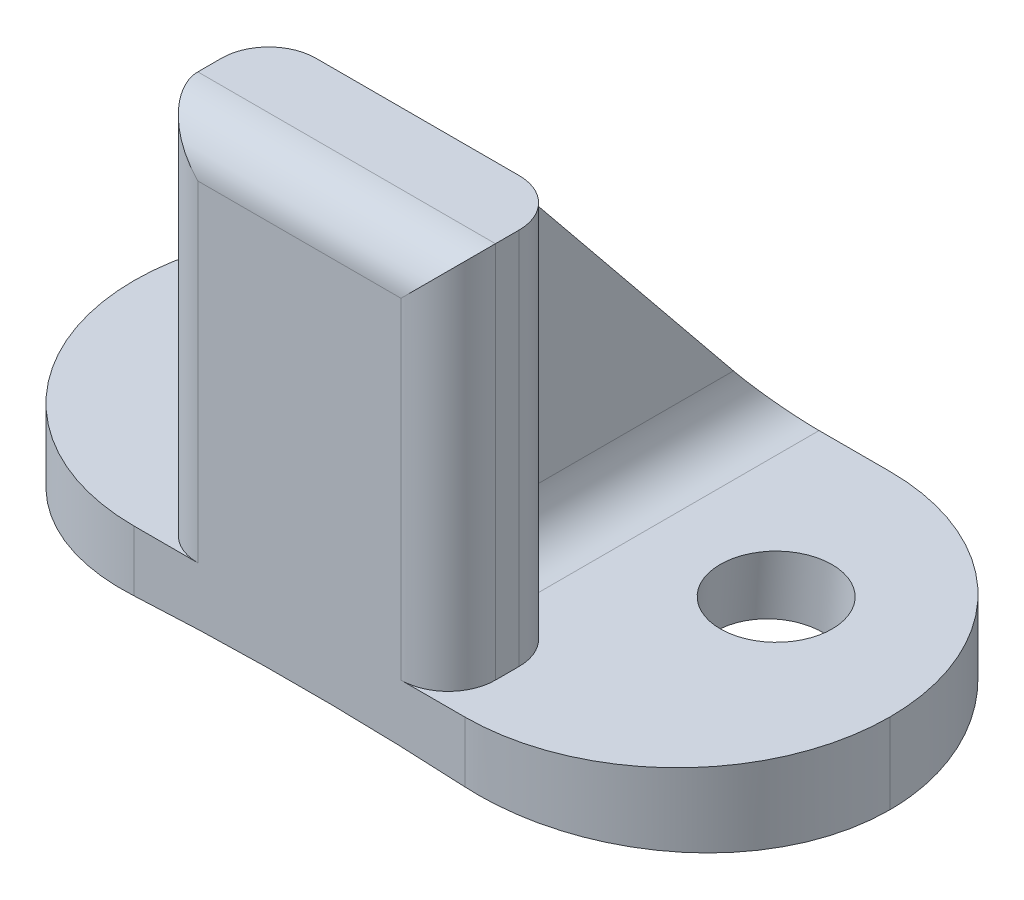
from build123d import *

# Parameters (mm, degrees)
SKETCH1_W               = 20.32
SKETCH1_H               = 23.8125
BOSS_EXTRUDE1_DEPTH     = 3
SKETCH3_R               = 1.500000048
CUT_EXTRUDE1_DEPTH      = 84.279291716
CUT_EXTRUDE2_DEPTH      = 23.075453704
CUT_EXTRUDE2_DEPTH_BACK = 23.075453704
SKETCH2_R               = 78.359
SKETCH4_W               = 22.86
SKETCH4_H               = 20.306074834
CUT_EXTRUDE3_DEPTH      = 12.3825
SKETCH9_W               = 8
SKETCH9_H               = 3.175
BOSS_EXTRUDE2_DEPTH     = 10.16
BOSS_EXTRUDE3_DEPTH     = 1.27
FILLET7_R               = 5.715
FILLET8_R               = 1.27
FILLET9_R               = 1.27


# Some blends are built 0.0001 mm under size
with BuildPart() as part:
    # Sketch1 → Boss-Extrude1 (new body)
    with BuildSketch(Plane(origin=(0, 0, 0), x_dir=(1, 0, 0), z_dir=(0, 1, 0))):
        with Locations((0, -7.46125)):
            Rectangle(SKETCH1_W, SKETCH1_H)
        Polygon((3.9, -10.985), (6, -10.985), (6, -13.985), (2.999999969, -13.985), (2.999999969, -17.16), (-2.999999969, -17.16), (-2.999999969, -13.985), (-6, -13.985), (-6, -10.985), (-3.9, -10.985), (-3.9, -6.985), (3.9, -6.985), align=None, mode=Mode.SUBTRACT)
    extrude(amount=BOSS_EXTRUDE1_DEPTH)

    # Sketch3 → Cut-Extrude1 (cut, through all)
    with BuildSketch(Plane(origin=(-5.581860717, -76.451458097, 0), x_dir=(0, 0, 1), z_dir=(0.07281799962939917, 0.9973452456045363, 0))):
        with Locations(Location((0, 5.59671863, 0), (0, 0, 270))):
            Circle(SKETCH3_R)
    cut_extrude1 = extrude(amount=CUT_EXTRUDE1_DEPTH, mode=Mode.SUBTRACT)

    # Mirror1: Cut-Extrude1 across plane
    add(cut_extrude1.mirror(Plane(origin=(0, 0, 0), x_dir=(0, 0, 1), z_dir=(1, 0, 0))), mode=Mode.SUBTRACT)

    # Sketch2 → Cut-Extrude2 (cut, two sides: drawn at the far end of the back side and taken through both)
    with BuildSketch(Plane.XY.offset(-CUT_EXTRUDE2_DEPTH_BACK)):
        with Locations((0, -76.858999952)):
            Circle(SKETCH2_R)
    extrude(amount=CUT_EXTRUDE2_DEPTH + CUT_EXTRUDE2_DEPTH_BACK, mode=Mode.SUBTRACT)

    # Sketch4 → Cut-Extrude3 (cut)
    with BuildSketch(Plane.XY.offset(19.3675)):
        with Locations((-1.27, 10.991574627)):
            Rectangle(SKETCH4_W, SKETCH4_H)
    extrude(amount=-CUT_EXTRUDE3_DEPTH, mode=Mode.SUBTRACT)

    # Sketch9 → Boss-Extrude2 (add)
    with BuildSketch(Plane(origin=(0, 3, 0), x_dir=(1, 0, 0), z_dir=(0, 1, 0))):
        with Locations((0, -5.3975)):
            Rectangle(SKETCH9_W, SKETCH9_H)
    extrude(amount=BOSS_EXTRUDE2_DEPTH)

    # Sketch10 → Boss-Extrude3 (add, symmetric)
    with BuildSketch(Plane(origin=(0, 0, 0), x_dir=(0, 0, -1), z_dir=(1, 0, 0))):
        Polygon((-3.81, 13.16), (4.445, 3), (-3.81, 3), align=None)
    extrude(amount=BOSS_EXTRUDE3_DEPTH, both=True)

    # Fillet7
    fillet7_edges = [part.edges().sort_by_distance(p)[0] for p in [
        (-10.16, 1.919268605, 6.985),
        (-10.16, 1.919268605, -4.445),
        (10.16, 1.919268605, -4.445),
        (10.16, 1.919268605, 6.985),
    ]]
    fillet(fillet7_edges, radius=FILLET7_R - 0.0001)  # a hair under: the kernel refuses the full size

    # Fillet8
    fillet8_edges = [part.edges().sort_by_distance(p)[0] for p in [
        (4, 8.08, 6.985),
        (4, 8.08, 3.81),
        (-4, 8.08, 3.81),
        (-4, 8.08, 6.985),
        (0, 13.16, 6.985),
    ]]
    fillet(fillet8_edges, radius=FILLET8_R)

    # Fillet9
    # the kernel refuses this fillet: 1.27 mm, written as the material it adds along each edge
    with BuildSketch(Plane(origin=(-1.27, 3, 3.81), x_dir=(0, 0, -1), z_dir=(0, 1, 0))) as fillet9_piece_1_section:
        with BuildLine():
            CenterArc((FILLET9_R, FILLET9_R), FILLET9_R, 180, 90)
            Line((0, FILLET9_R), (0, 0))
            Line((0, 0), (FILLET9_R, 0))
        make_face()
    fillet9_piece_1 = extrude(amount=10.16, mode=Mode.PRIVATE)
    fillet9_piece_1 = split(fillet9_piece_1, bisect_by=Plane(origin=(-1.56303802, 9.860421862, 1.129092762), z_dir=(0, -0.630592625094466, 0.7761140001162654)), keep=Keep.TOP, mode=Mode.PRIVATE)
    add(fillet9_piece_1)
    with BuildSketch(Plane(origin=(-1.27, 3, -4.445), x_dir=(-1, 0, 0), z_dir=(0, 0, 1))) as fillet9_piece_2_section:
        with BuildLine():
            CenterArc((FILLET9_R, -FILLET9_R), FILLET9_R, 90, 90)
            Line((0, -FILLET9_R), (0, 0))
            Line((0, 0), (FILLET9_R, 0))
        make_face()
    fillet9_piece_2 = extrude(amount=11.43, mode=Mode.PRIVATE)
    fillet9_piece_2 = split(fillet9_piece_2, bisect_by=Plane(origin=(-1.561973496, 5.244551774, -2.621301684), z_dir=(0, -0.630592625094466, 0.7761140001162654)), keep=Keep.TOP, mode=Mode.PRIVATE)
    add(fillet9_piece_2)
    with BuildSketch(Plane(origin=(1.27, 3, 3.81), x_dir=(0, 0, -1), z_dir=(0, 1, 0))) as fillet9_piece_3_section:
        with BuildLine():
            CenterArc((FILLET9_R, -FILLET9_R), FILLET9_R, 90, 90)
            Line((0, -FILLET9_R), (0, 0))
            Line((0, 0), (FILLET9_R, 0))
        make_face()
    fillet9_piece_3 = extrude(amount=10.16, mode=Mode.PRIVATE)
    fillet9_piece_3 = split(fillet9_piece_3, bisect_by=Plane(origin=(1.56303802, 9.860421862, 1.129092762), z_dir=(0, -0.630592625094466, 0.7761140001162654)), keep=Keep.TOP, mode=Mode.PRIVATE)
    add(fillet9_piece_3)
    with BuildSketch(Plane(origin=(1.27, 3, -4.445), x_dir=(1, 0, 0), z_dir=(0, 0, 1))) as fillet9_piece_4_section:
        with BuildLine():
            CenterArc((FILLET9_R, FILLET9_R), FILLET9_R, 180, 90)
            Line((0, FILLET9_R), (0, 0))
            Line((0, 0), (FILLET9_R, 0))
        make_face()
    fillet9_piece_4 = extrude(amount=11.43, mode=Mode.PRIVATE)
    fillet9_piece_4 = split(fillet9_piece_4, bisect_by=Plane(origin=(1.561973496, 5.244551774, -2.621301684), z_dir=(0, -0.630592625094466, 0.7761140001162654)), keep=Keep.TOP, mode=Mode.PRIVATE)
    add(fillet9_piece_4)


solid = part.part
